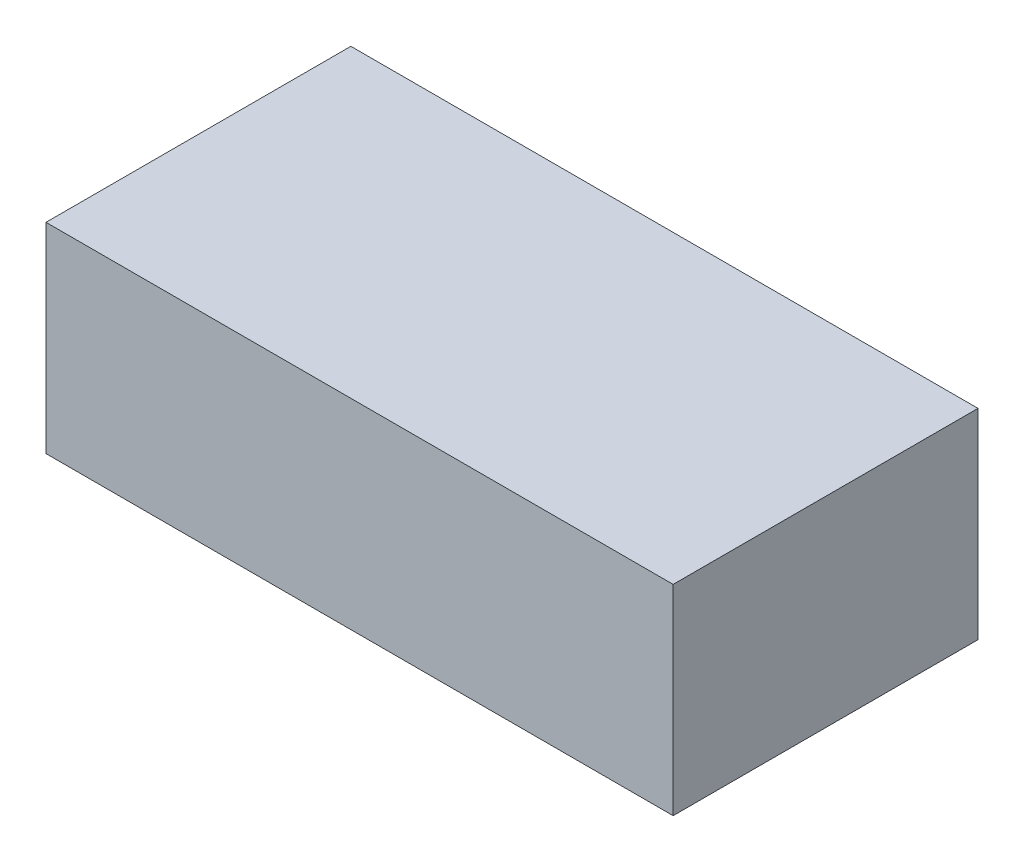
from build123d import *

# Parameters (mm, degrees)
SKETCH1_W           = 72
SKETCH1_H           = 35
BOSS_EXTRUDE1_DEPTH = 23


with BuildPart() as part:
    # Sketch1 → Boss-Extrude1 (new body)
    with BuildSketch(Plane(origin=(0, 0, 0), x_dir=(1, 0, 0), z_dir=(0, 1, 0))):
        Rectangle(SKETCH1_W, SKETCH1_H)
    extrude(amount=BOSS_EXTRUDE1_DEPTH)


solid = part.part
